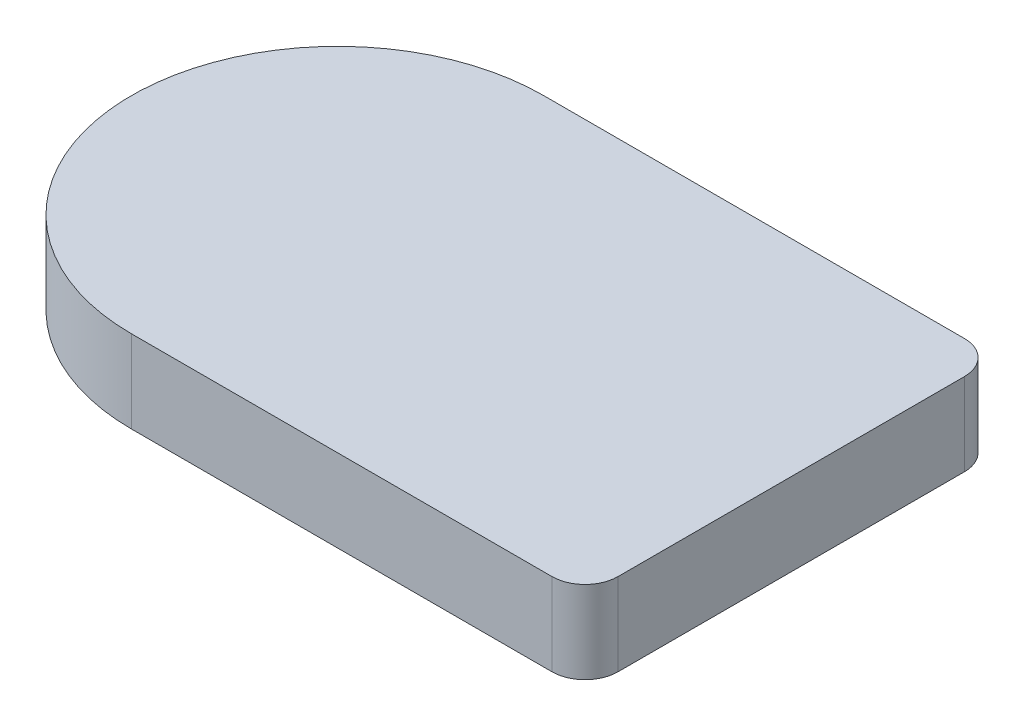
from build123d import *

# Parameters (mm, degrees)
SKETCH1_W           = 40
SKETCH1_H           = 25
BOSS_EXTRUDE1_DEPTH = 5
CUT_EXTRUDE1_DEPTH  = 25.109126902
FILLET1_R           = 2


with BuildPart() as part:
    # Sketch1 → Boss-Extrude1 (new body)
    with BuildSketch(Plane(origin=(0, 0, 0), x_dir=(1, 0, 0), z_dir=(0, 1, 0))):
        Rectangle(SKETCH1_W, SKETCH1_H)
    extrude(amount=BOSS_EXTRUDE1_DEPTH)

    # Sketch2 → Cut-Extrude1 (cut, through all)
    with BuildSketch(Plane(origin=(0, 5, 0), x_dir=(1, 0, 0), z_dir=(0, 1, 0))):
        with BuildLine():
            Line((-20, -12.5), (-7.50000001, -12.5))
            ThreePointArc((-7.50000001, -12.5), (-16.338834768, -8.838834761), (-20, 0))
            Line((-20, 0), (-20, -12.5))
        make_face()
        with BuildLine():
            ThreePointArc((-20, 0), (-16.338834759, 8.83883477), (-7.499999984, 12.5))
            Line((-7.499999984, 12.5), (-20, 12.5))
            Line((-20, 12.5), (-20, 0))
        make_face()
    extrude(amount=-CUT_EXTRUDE1_DEPTH, mode=Mode.SUBTRACT)

    # Fillet1
    fillet1_edges = [part.edges().sort_by_distance(p)[0] for p in [
        (20, 2.5, 12.5),
        (20, 2.5, -12.5),
    ]]
    fillet(fillet1_edges, radius=FILLET1_R)


solid = part.part
